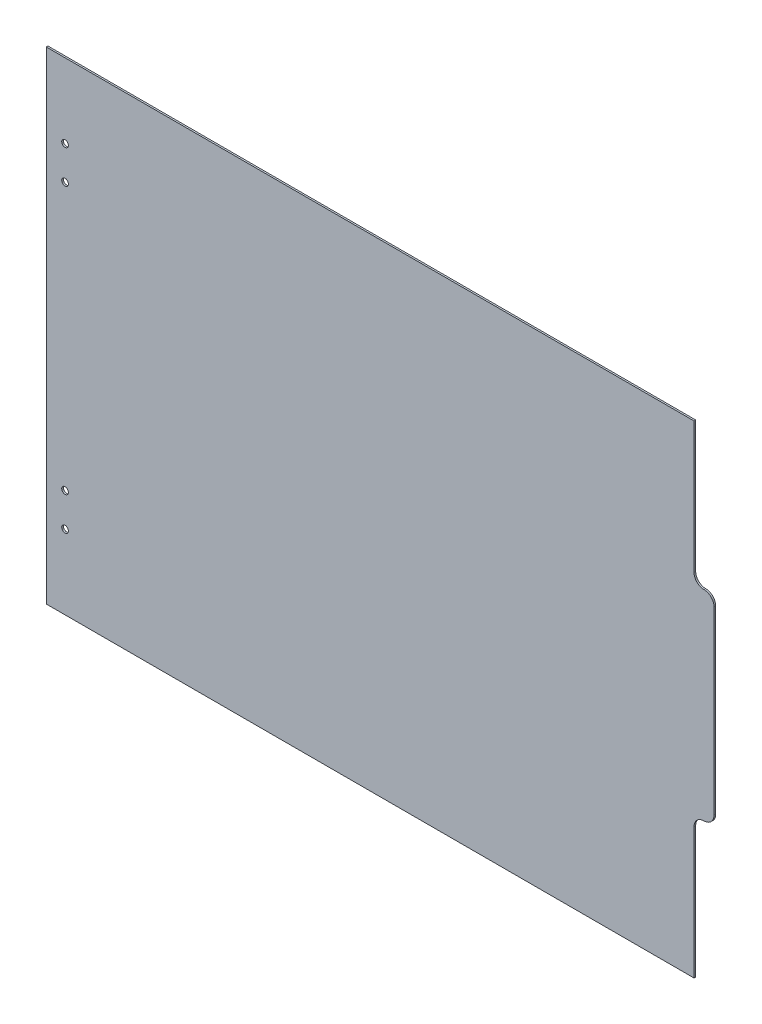
from build123d import *

# Parameters (mm, degrees)
SKETCH1_W           = 388
SKETCH1_H           = 289
SKETCH1_R           = 2
BOSS_EXTRUDE1_DEPTH = 1
SKETCH3_W           = 12
SKETCH3_H           = 120
BOSS_EXTRUDE2_DEPTH = 1
FILLET1_R           = 6


with BuildPart() as part:
    # Sketch1 → Boss-Extrude1 (new body)
    with BuildSketch(Plane.XY):
        Rectangle(SKETCH1_W, SKETCH1_H)
        with Locations((-182.759742869, 100.000000002)):
            Circle(SKETCH1_R, mode=Mode.SUBTRACT)
        with Locations((-182.759742868, 80.000000002)):
            Circle(SKETCH1_R, mode=Mode.SUBTRACT)
        with Locations((-182.759742869, -100)):
            Circle(SKETCH1_R, mode=Mode.SUBTRACT)
        with Locations((-182.759742869, -80)):
            Circle(SKETCH1_R, mode=Mode.SUBTRACT)
    extrude(amount=BOSS_EXTRUDE1_DEPTH)

    # Sketch3 → Boss-Extrude2 (add)
    with BuildSketch(Plane.XY.offset(1)):
        with Locations((200, 0)):
            Rectangle(SKETCH3_W, SKETCH3_H)
    extrude(amount=-BOSS_EXTRUDE2_DEPTH)

    # Fillet1
    fillet1_edges = [part.edges().sort_by_distance(p)[0] for p in [
        (194, -60, 0.5),
        (194, 60, 0.5),
    ]]
    fillet(fillet1_edges, radius=FILLET1_R)
    fillet1_2_edges = [part.edges().sort_by_distance(p)[0] for p in [
        (206, -60, 0.5),
        (206, 60, 0.5),
    ]]
    fillet(fillet1_2_edges, radius=FILLET1_R - 0.0001)  # a hair under: the kernel refuses the full size


solid = part.part
